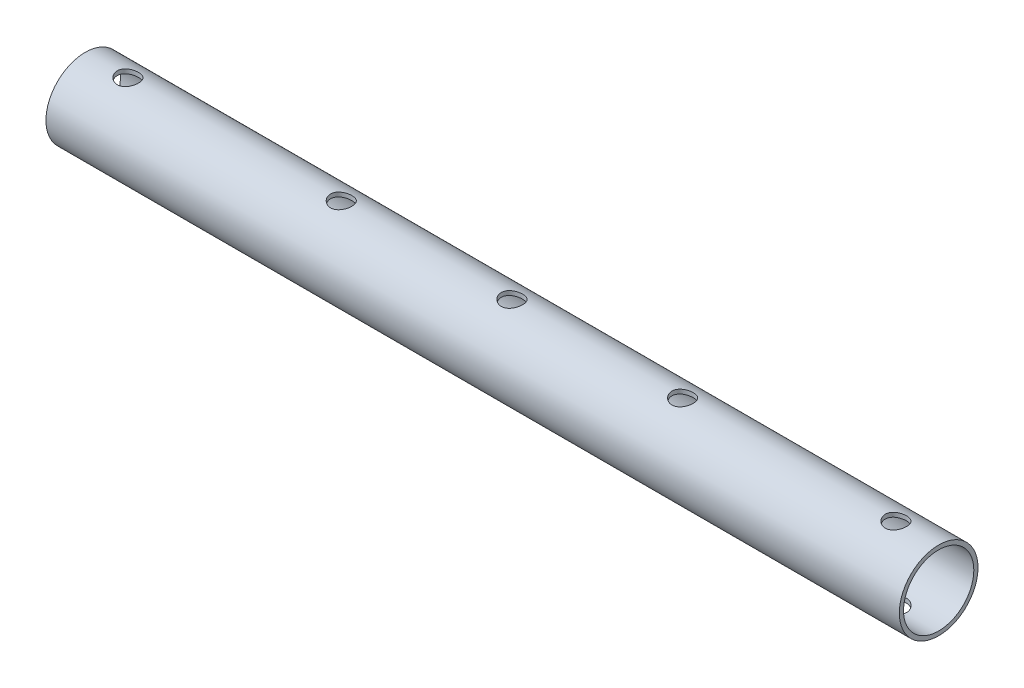
from build123d import *

# Parameters (mm, degrees)
SKETCH3_R               = 11.7094
SKETCH3_R_2             = 10.4648
BOSS_EXTRUDE1_DEPTH     = 254
CUT_EXTRUDE1_DEPTH      = 255.539230958
CUT_EXTRUDE1_DEPTH_BACK = 255.539230958
SKETCH4_R               = 3.175


with BuildPart() as part:
    # Sketch3 → Boss-Extrude1 (new body)
    with BuildSketch(Plane(origin=(0, 0, 0), x_dir=(0, 0, -1), z_dir=(1, 0, 0))):
        Circle(SKETCH3_R)
        Circle(SKETCH3_R_2, mode=Mode.SUBTRACT)
    extrude(amount=BOSS_EXTRUDE1_DEPTH)

    # Sketch4 → Cut-Extrude1 (cut, two sides: drawn at the far end of the back side and taken through both)
    with BuildSketch(Plane(origin=(0, 0, 0), x_dir=(1, 0, 0), z_dir=(0, 1, 0)).offset(-CUT_EXTRUDE1_DEPTH_BACK)):
        with Locations((127, 0)):
            Circle(SKETCH4_R)
        with Locations((12.7, 0)):
            Circle(SKETCH4_R)
        with Locations((76.2, 0)):
            Circle(SKETCH4_R)
        with Locations((177.8, 0)):
            Circle(SKETCH4_R)
        with Locations((241.3, 0)):
            Circle(SKETCH4_R)
    extrude(amount=CUT_EXTRUDE1_DEPTH + CUT_EXTRUDE1_DEPTH_BACK, mode=Mode.SUBTRACT)


solid = part.part
